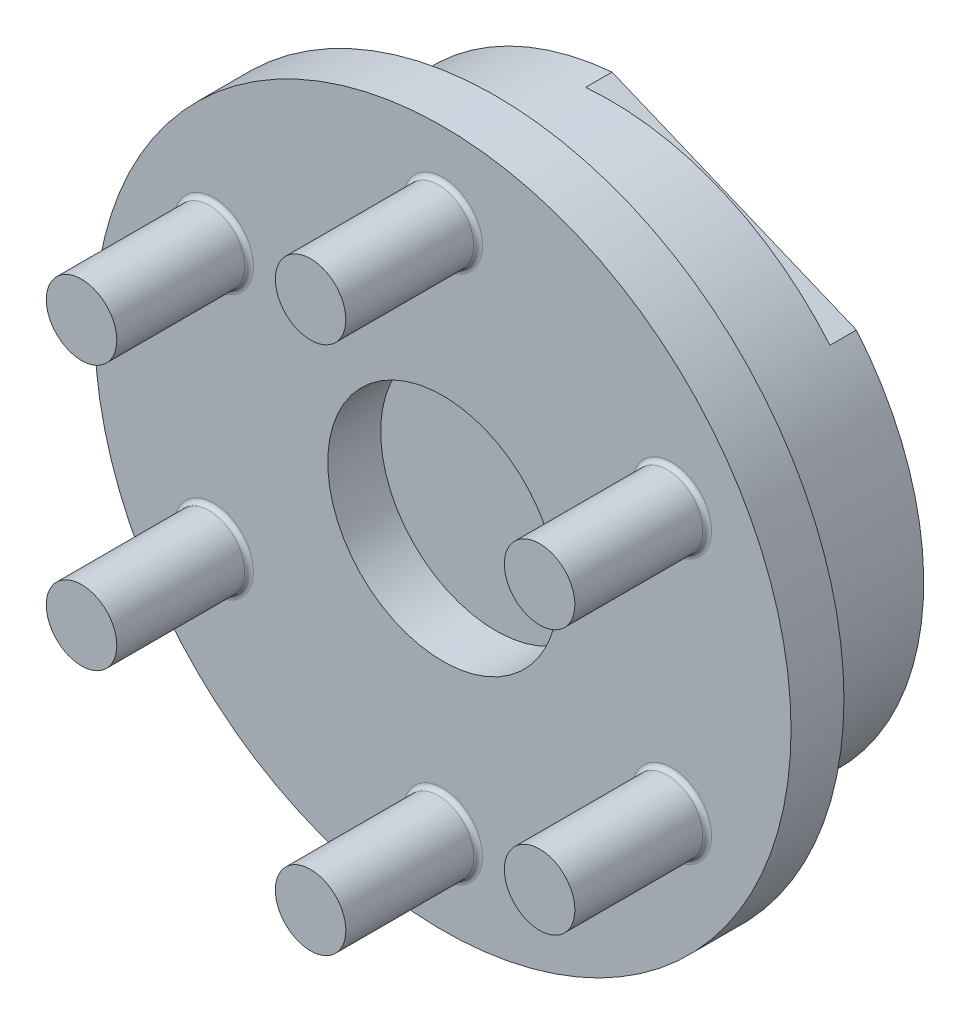
from build123d import *

# Parameters (mm, degrees)
SKETCH1_R                   = 39.5
SKETCH1_R_2                 = 13.05
BOSS_EXTRUDE1_DEPTH         = 6
SKETCH2_R                   = 32.55
BOSS_EXTRUDE3_DEPTH         = 16
SKETCH5_R                   = 4
BOSS_EXTRUDE4_DEPTH         = 15
FILLET1_R                   = 0.5
M5_TAPPED_HOLE1_D           = 4.2
M5_TAPPED_HOLE1_DEPTH       = 7
M5_TAPPED_HOLE1_CSINK_D     = 5.05
M5_TAPPED_HOLE1_CSINK_ANGLE = 90
M5_TAPPED_HOLE1_TIP         = 1.2618073
SKETCH9_R                   = 18.5
CUT_EXTRUDE1_DEPTH          = 13
CUT_EXTRUDE2_START          = -3
CUT_EXTRUDE2_DEPTH          = 3


with BuildPart() as part:
    # Sketch1 → Boss-Extrude1 (new body)
    with BuildSketch(Plane.XY):
        Circle(SKETCH1_R)
        Circle(SKETCH1_R_2, mode=Mode.SUBTRACT)
    extrude(amount=-BOSS_EXTRUDE1_DEPTH)

    # Sketch2 → Boss-Extrude3 (add)
    with BuildSketch(Plane(origin=(0, 0, -6), x_dir=(-1, 0, 0), z_dir=(0, 0, -1))):
        Circle(SKETCH2_R)
    extrude(amount=BOSS_EXTRUDE3_DEPTH)

    # Sketch5 → Boss-Extrude4 (add)
    with BuildSketch(Plane.XY):
        with Locations((0, 30)):
            Circle(SKETCH5_R)
        with Locations((25.980762114, 15)):
            Circle(SKETCH5_R)
        with Locations((25.980762114, -15)):
            Circle(SKETCH5_R)
        with Locations((0, -30)):
            Circle(SKETCH5_R)
        with Locations((-25.980762114, -15)):
            Circle(SKETCH5_R)
        with Locations((-25.980762114, 15)):
            Circle(SKETCH5_R)
    extrude(amount=BOSS_EXTRUDE4_DEPTH)

    # Fillet1
    fillet1_edges = [part.edges().sort_by_distance(p)[0] for p in [
        (21.980762114, 15, 0),
        (21.980762114, -15, 0),
        (-4, -30, 0),
        (-29.980762114, -15, 0),
        (-29.980762114, 15, 0),
        (-4, 30, 0),
    ]]
    fillet(fillet1_edges, radius=FILLET1_R)

    # M5 Tapped Hole1
    with Locations(Plane(origin=(0, 0, -22), x_dir=(-1, 0, 0), z_dir=(0, 0, -1))):
        with Locations((0, 25), (-17.67766953, 17.67766953), (-25, 0), (17.67766953, 17.67766953), (25, 0), (-17.67766953, -17.67766953), (0, -25), (17.67766953, -17.67766953)):
            CounterSinkHole(M5_TAPPED_HOLE1_D / 2, M5_TAPPED_HOLE1_CSINK_D / 2, depth=M5_TAPPED_HOLE1_DEPTH, counter_sink_angle=M5_TAPPED_HOLE1_CSINK_ANGLE)
            with Locations((0, 0, -(M5_TAPPED_HOLE1_DEPTH + M5_TAPPED_HOLE1_TIP / 2))):  # 118° drill point
                Cone(0, M5_TAPPED_HOLE1_D / 2, M5_TAPPED_HOLE1_TIP, mode=Mode.SUBTRACT)

    # Sketch9 → Cut-Extrude1 (cut)
    with BuildSketch(Plane(origin=(0, 0, -22), x_dir=(-1, 0, 0), z_dir=(0, 0, -1))):
        Circle(SKETCH9_R)
    extrude(amount=-CUT_EXTRUDE1_DEPTH, mode=Mode.SUBTRACT)

    # Sketch10 → Cut-Extrude2 (cut)
    with BuildSketch(Plane(origin=(0, 0, -22), x_dir=(-1, 0, 0), z_dir=(0, 0, -1)).offset(CUT_EXTRUDE2_START)):
        with BuildLine():
            Line((24.91305896, -20.948555875), (-2.803327015, -32.429058846))
            ThreePointArc((-2.803327015, -32.429058846), (12.456345723, -30.072278783), (24.91305896, -20.948555875))
        make_face()
        with BuildLine():
            Line((-24.91305896, 20.948555875), (2.803327015, 32.429058846))
            ThreePointArc((2.803327015, 32.429058846), (-12.456345723, 30.072278783), (-24.91305896, 20.948555875))
        make_face()
    extrude(amount=CUT_EXTRUDE2_DEPTH, mode=Mode.SUBTRACT)


solid = part.part
